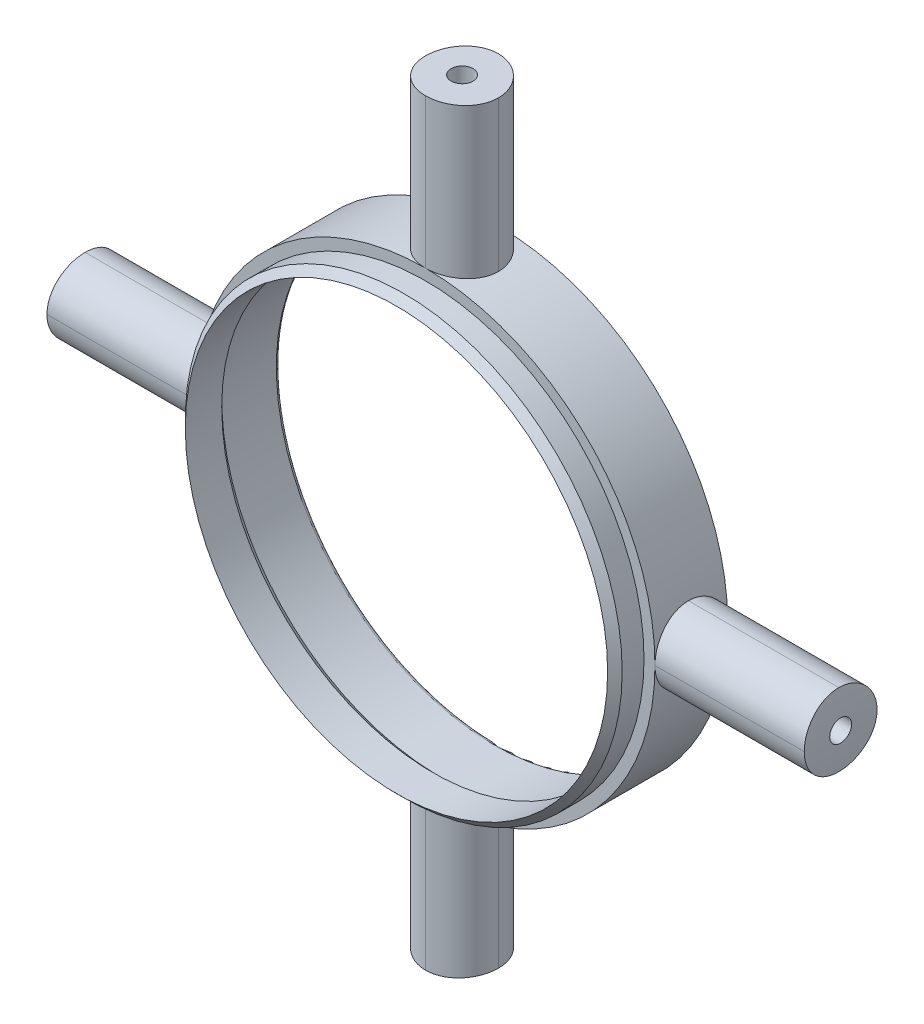
from build123d import *

# Parameters (mm, degrees)
SKETCH1_R                = 31.5
SKETCH1_R_2              = 30
BOSS_EXTRUDE1_DEPTH      = 10
BOSS_EXTRUDE3_START      = -0.399357
SKETCH4_W                = 10
SKETCH4_H                = 10
BOSS_EXTRUDE3_DEPTH      = 30.399357
FILLET1_R                = 5
SKETCH6_R                = 1.5
CUT_EXTRUDE8_DEPTH       = 30
CIRPATTERN1_COUNT        = 4
FILLET1_OF_CIRPATTERN1_R = 5
SKETCH5_R                = 69.091239082
SKETCH5_R_2              = 52
CUT_EXTRUDE7_DEPTH       = 200
BOSS_EXTRUDE4_DEPTH      = 4
BOSS_EXTRUDE4_DEPTH_BACK = 2
SKETCH7_R                = 30
SKETCH7_R_2              = 29
CHAMFER1_SIZE            = 1
FILLET2_R                = 0.5


with BuildPart() as part:
    # Sketch1 → Boss-Extrude1 (new body)
    with BuildSketch(Plane.XY):
        Circle(SKETCH1_R)
        Circle(SKETCH1_R_2, mode=Mode.SUBTRACT)
    extrude(amount=BOSS_EXTRUDE1_DEPTH)

    # Sketch4 → Boss-Extrude3 (add)
    with BuildSketch(Plane.ZY.offset(31.5).offset(BOSS_EXTRUDE3_START)):
        with Locations((5, 0)):
            Rectangle(SKETCH4_W, SKETCH4_H)
    boss_extrude3 = extrude(amount=BOSS_EXTRUDE3_DEPTH)

    # Fillet1
    fillet1_edges = [part.edges().sort_by_distance(p)[0] for p in [
        (-46.3003215, 5, 10),
        (-46.3003215, -5, 10),
        (-46.3003215, 5, 0),
        (-46.3003215, -5, 0),
    ]]
    fillet(fillet1_edges, radius=FILLET1_R - 0.0001)  # a hair under: the kernel refuses the full size

    # Sketch6 → Cut-Extrude8 (cut)
    with BuildSketch(Plane.ZY.offset(61.5)):
        with Locations((5, 0)):
            Circle(SKETCH6_R)
    cut_extrude8 = extrude(amount=-CUT_EXTRUDE8_DEPTH, mode=Mode.SUBTRACT)

    # CirPattern1: Boss-Extrude3, Cut-Extrude8 ×4 about axis
    cirpattern1_axis = Axis((0, 0, 0), (0, 0, 1))
    add([boss_extrude3.rotate(cirpattern1_axis, i * 360 / CIRPATTERN1_COUNT) for i in range(1, CIRPATTERN1_COUNT)])
    add([cut_extrude8.rotate(cirpattern1_axis, i * 360 / CIRPATTERN1_COUNT) for i in range(1, CIRPATTERN1_COUNT)], mode=Mode.SUBTRACT)

    # Fillet1 of CirPattern1
    fillet1_of_cirpattern1_edges = [part.edges().sort_by_distance(p)[0] for p in [
        (-5, -46.3003215, 10),
        (5, -46.3003215, 10),
        (-5, -46.3003215, 0),
        (5, -46.3003215, 0),
        (46.3003215, -5, 10),
        (46.3003215, 5, 10),
        (46.3003215, -5, 0),
        (46.3003215, 5, 0),
        (5, 46.3003215, 10),
        (-5, 46.3003215, 10),
        (5, 46.3003215, 0),
        (-5, 46.3003215, 0),
    ]]
    fillet(fillet1_of_cirpattern1_edges, radius=FILLET1_OF_CIRPATTERN1_R - 0.0001)  # a hair under: the kernel refuses the full size

    # Sketch5 → Cut-Extrude7 (cut)
    with BuildSketch(Plane.XY.offset(10)):
        Circle(SKETCH5_R)
        Circle(SKETCH5_R_2, mode=Mode.SUBTRACT)
    extrude(amount=-CUT_EXTRUDE7_DEPTH, mode=Mode.SUBTRACT)

    # Sketch7 → Boss-Extrude4 (add, two sides: drawn at the far end of the back side and taken through both)
    with BuildSketch(Plane.XY.offset(10).offset(-BOSS_EXTRUDE4_DEPTH_BACK)):
        Circle(SKETCH7_R)
        Circle(SKETCH7_R_2, mode=Mode.SUBTRACT)
    extrude(amount=BOSS_EXTRUDE4_DEPTH + BOSS_EXTRUDE4_DEPTH_BACK)

    # Chamfer1
    chamfer1_edges = [part.edges().sort_by_distance(p)[0] for p in [
        (-30, 0, 14),
        (-29, 0, 8),
    ]]
    chamfer(chamfer1_edges, length=CHAMFER1_SIZE - 0.0001)  # a hair under: the kernel refuses the full size

    # Fillet2
    fillet2_edges = [part.edges().sort_by_distance(p)[0] for p in [
        (-30, 0, 0),
    ]]
    fillet(fillet2_edges, radius=FILLET2_R)


solid = part.part
